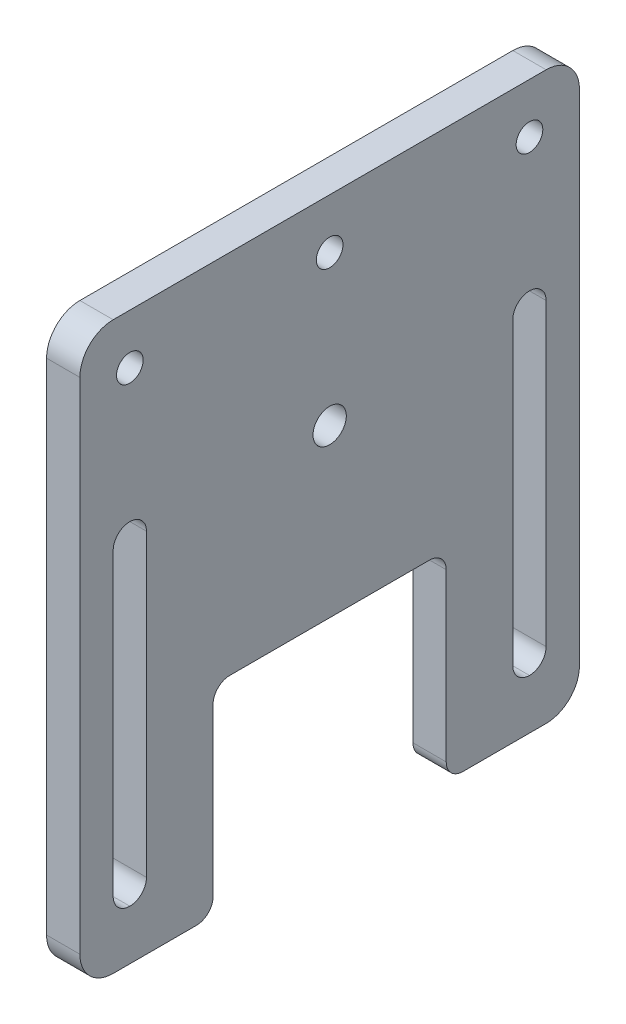
from build123d import *

# Parameters (mm, degrees)
SKETCH1_W               = 150
SKETCH1_H               = 170
BOSS_EXTRUDE1_DEPTH     = 10
CUT_EXTRUDE1_DEPTH      = 114.798066767
CUT_EXTRUDE1_DEPTH_BACK = 114.798066767
SKETCH4_R               = 4
SKETCH4_R_2             = 5
SKETCH4_W               = 10
SKETCH4_H               = 100
FILLET1_R               = 5
FILLET2_R               = 10


with BuildPart() as part:
    # Sketch1 → Boss-Extrude1 (new body)
    with BuildSketch(Plane(origin=(0, 0, 0), x_dir=(0, 0, -1), z_dir=(1, 0, 0))):
        Rectangle(SKETCH1_W, SKETCH1_H)
    extrude(amount=BOSS_EXTRUDE1_DEPTH)

    # Sketch4 → Cut-Extrude1 (cut, two sides: drawn at the far end of the back side and taken through both)
    with BuildSketch(Plane.ZY.offset(-CUT_EXTRUDE1_DEPTH_BACK)):
        with Locations((-60, 70)):
            Circle(SKETCH4_R)
        with Locations((0, 70)):
            Circle(SKETCH4_R)
        with Locations((60, 70)):
            Circle(SKETCH4_R)
        with Locations((0, 25)):
            Circle(SKETCH4_R_2)
        with BuildLine():
            Line((-40, -85), (40, -85))
            ThreePointArc((40, -85), (36.464466094, -83.535533906), (35, -80))
            Line((35, -80), (35, -30))
            ThreePointArc((35, -30), (33.535533906, -26.464466094), (30, -25))
            Line((30, -25), (-30, -25))
            ThreePointArc((-30, -25), (-33.535533906, -26.464466094), (-35, -30))
            Line((-35, -30), (-35, -80))
            ThreePointArc((-35, -80), (-36.464466094, -83.535533906), (-40, -85))
        make_face()
        with Locations((60, -20)):
            Rectangle(SKETCH4_W, SKETCH4_H)
        with Locations((-60, -20)):
            Rectangle(SKETCH4_W, SKETCH4_H)
    extrude(amount=CUT_EXTRUDE1_DEPTH + CUT_EXTRUDE1_DEPTH_BACK, mode=Mode.SUBTRACT)

    # Fillet1
    fillet1_edges = [part.edges().sort_by_distance(p)[0] for p in [
        (5, 30, 55),
        (5, 30, 65),
        (5, -70, 65),
        (5, -70, 55),
        (5, 30, -65),
        (5, 30, -55),
        (5, -70, -55),
        (5, -70, -65),
    ]]
    fillet(fillet1_edges, radius=FILLET1_R - 0.0001)  # a hair under: the kernel refuses the full size

    # Fillet2
    fillet2_edges = [part.edges().sort_by_distance(p)[0] for p in [
        (5, -85, -75),
        (5, -85, 75),
        (5, 85, 75),
        (5, 85, -75),
    ]]
    fillet(fillet2_edges, radius=FILLET2_R)


solid = part.part
